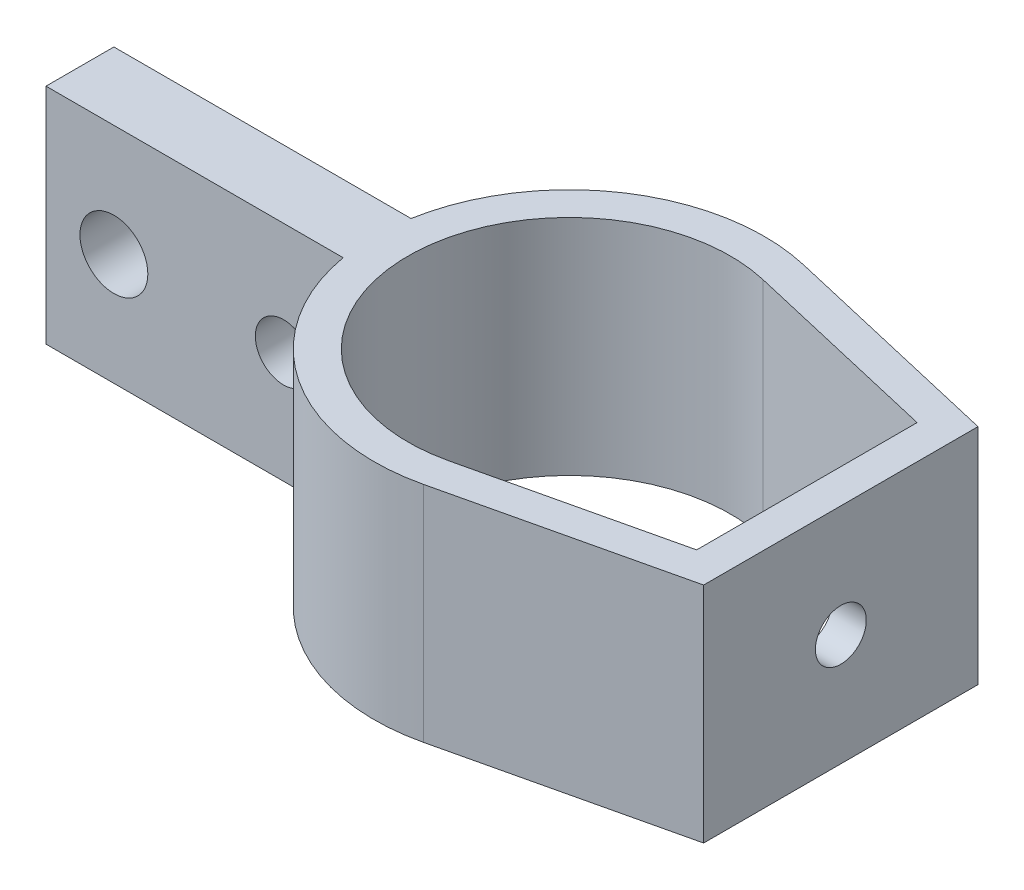
from build123d import *

# Parameters (mm, degrees)
BOSS_EXTRUDE1_DEPTH = 10.033
SKETCH2_R           = 3.048
SKETCH2_R_2         = 2.54
CUT_EXTRUDE1_DEPTH  = 10.033
SKETCH3_R           = 2.286
CUT_EXTRUDE2_DEPTH  = 10.033


with BuildPart() as part:
    # Sketch1 → Boss-Extrude1 (new, symmetric)
    with BuildSketch(Plane(origin=(0, 0, 0), x_dir=(1, 0, 0), z_dir=(0, 1, 0))):
        with BuildLine():
            Line((24.384, -12.319), (24.384, 12.319))
            Line((24.384, 12.319), (3.973043901, 17.069727536))
            ThreePointArc((3.973043901, 17.069727536), (-9.658201012, 14.624630908), (-17.258921519, 3.048))
            Line((-17.258921519, 3.048), (-43.942, 3.048))
            Line((-43.942, 3.048), (-43.942, -3.048))
            Line((-43.942, -3.048), (-17.258921519, -3.048))
            ThreePointArc((-17.258921519, -3.048), (-9.658201012, -14.624630908), (3.973043901, -17.069727536))
            Line((3.973043901, -17.069727536), (24.384, -12.319))
        make_face()
        with BuildLine():
            Line((21.336, -9.898960775), (21.336, 9.898960775))
            Line((21.336, 9.898960775), (3.282079744, 14.101079269))
            ThreePointArc((3.282079744, 14.101079269), (-14.478, 0), (3.282079744, -14.101079269))
            Line((3.282079744, -14.101079269), (21.336, -9.898960775))
        make_face(mode=Mode.SUBTRACT)
    extrude(amount=BOSS_EXTRUDE1_DEPTH, both=True)

    # Sketch2 → Cut-Extrude1 (cut, symmetric)
    with BuildSketch(Plane.XY.offset(3.048)):
        with Locations((-37.846, 0)):
            Circle(SKETCH2_R)
        with Locations((-22.606, 0)):
            Circle(SKETCH2_R_2)
    extrude(amount=CUT_EXTRUDE1_DEPTH, both=True, mode=Mode.SUBTRACT)

    # Sketch3 → Cut-Extrude2 (cut, symmetric)
    with BuildSketch(Plane(origin=(24.384, 0, 0), x_dir=(0, 0, -1), z_dir=(1, 0, 0))):
        Circle(SKETCH3_R)
    extrude(amount=CUT_EXTRUDE2_DEPTH, both=True, mode=Mode.SUBTRACT)


solid = part.part
